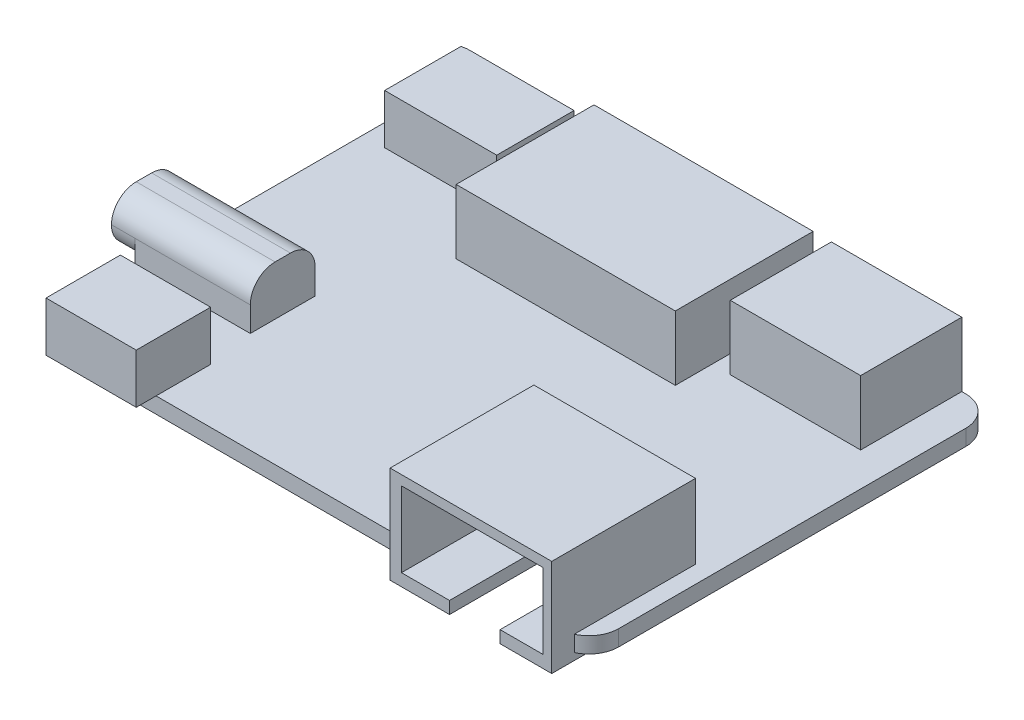
from build123d import *

# Parameters (mm, degrees)
BOSS_EXTRUDE1_DEPTH      = 1.6
BOSS_EXTRUDE2_DEPTH      = 9.1
BOSS_EXTRUDE2_DEPTH_BACK = 0.7
BOSS_EXTRUDE3_START      = 1.6
SKETCH1_4_W              = 22.1
SKETCH1_4_H              = 13.9
SKETCH1_4_W_2            = 13.15
SKETCH1_4_H_2            = 10.2
BOSS_EXTRUDE3_DEPTH      = 6.5
BOSS_EXTRUDE4_START      = 1.6
SKETCH1_5_W              = 9.1
SKETCH1_5_H              = 7.5
SKETCH1_5_W_2            = 14
SKETCH1_5_H_2            = 6.55
BOSS_EXTRUDE4_DEPTH      = 5
SKETCH2_W                = 10.965284592
SKETCH2_H                = 1.785046329
CUT_EXTRUDE1_DEPTH       = 9
SKETCH3_W                = 5.100132369
SKETCH3_H                = 1.23427986
SKETCH3_W_2              = 14.280370632
SKETCH3_H_2              = 7.586446898
CUT_EXTRUDE2_DEPTH       = 12
FILLET1_R                = 2.5


with BuildPart() as part:
    # Sketch1 → Boss-Extrude1 (new body)
    with BuildSketch(Plane(origin=(0, 0, 0), x_dir=(1, 0, 0), z_dir=(0, 1, 0))):
        with BuildLine():
            ThreePointArc((0, 3), (0.878679656, 0.878679656), (3, 0))
            Line((3, 0), (53, 0))
            ThreePointArc((53, 0), (55.121320344, 0.878679656), (56, 3))
            Line((56, 3), (56, 38))
            ThreePointArc((56, 38), (55.121320344, 40.121320344), (53, 41))
            Line((53, 41), (3, 41))
            ThreePointArc((3, 41), (0.878679656, 40.121320344), (0, 38))
            Line((0, 38), (0, 3))
        make_face()
    extrude(amount=BOSS_EXTRUDE1_DEPTH)

    # Sketch1<3> → Boss-Extrude2 (add, two sides: drawn at the far end of the back side and taken through both)
    with BuildSketch(Plane(origin=(0, 0, 0), x_dir=(1, 0, 0), z_dir=(0, 1, 0)).offset(-BOSS_EXTRUDE2_DEPTH_BACK)):
        with BuildLine():
            Line((37.95, 12.5), (37.95, 0))
            Line((37.95, 0), (53, 0))
            ThreePointArc((53, 0), (53.639713183, 0.068998969), (54.25, 0.272821971))
            Line((54.25, 0.272821971), (54.25, 12.5))
            Line((54.25, 12.5), (37.95, 12.5))
        make_face()
        with BuildLine():
            Line((53, 0), (37.95, 0))
            Line((37.95, 0), (37.95, -2))
            Line((37.95, -2), (54.25, -2))
            Line((54.25, -2), (54.25, 0.272821971))
            ThreePointArc((54.25, 0.272821971), (53.639713183, 0.068998969), (53, 0))
        make_face()
    extrude(amount=BOSS_EXTRUDE2_DEPTH + BOSS_EXTRUDE2_DEPTH_BACK)

    # Sketch1<4> → Boss-Extrude3 (add)
    with BuildSketch(Plane(origin=(0, 0, 0), x_dir=(1, 0, 0), z_dir=(0, 1, 0)).offset(BOSS_EXTRUDE3_START)):
        with Locations((26.561479759, 34.05)):
            Rectangle(SKETCH1_4_W, SKETCH1_4_H)
        with Locations((46.025, 35.9)):
            Rectangle(SKETCH1_4_W_2, SKETCH1_4_H_2)
    extrude(amount=BOSS_EXTRUDE3_DEPTH)

    # Sketch1<5> → Boss-Extrude4 (add)
    with BuildSketch(Plane(origin=(0, 0, 0), x_dir=(1, 0, 0), z_dir=(0, 1, 0)).offset(BOSS_EXTRUDE4_START)):
        with Locations((7.8, 1.75)):
            Rectangle(SKETCH1_5_W, SKETCH1_5_H)
        with Locations((4.65, 13.475)):
            Rectangle(SKETCH1_5_W_2, SKETCH1_5_H_2)
        with BuildLine():
            ThreePointArc((3, 41), (2.596328956, 40.972717559), (2.2, 40.891366459))
            Line((2.2, 40.891366459), (2.2, 33.2))
            Line((2.2, 33.2), (13.5, 33.2))
            Line((13.5, 33.2), (13.5, 41))
            Line((13.5, 41), (3, 41))
        make_face()
    extrude(amount=BOSS_EXTRUDE4_DEPTH)

    # Sketch2 → Cut-Extrude1 (cut)
    with BuildSketch(Plane(origin=(0, 0, -41), x_dir=(-1, 0, 0), z_dir=(0, 0, -1))):
        with Locations((-45.98237221, 5.889418847)):
            Rectangle(SKETCH2_W, SKETCH2_H)
    extrude(amount=-CUT_EXTRUDE1_DEPTH, mode=Mode.SUBTRACT)

    # Sketch3 → Cut-Extrude2 (cut)
    with BuildSketch(Plane.XY.offset(2)):
        with Locations((46.492385447, -0.08286007)):
            Rectangle(SKETCH3_W, SKETCH3_H)
        with Locations((46.237378828, 4.327503309)):
            Rectangle(SKETCH3_W_2, SKETCH3_H_2)
    extrude(amount=-CUT_EXTRUDE2_DEPTH, mode=Mode.SUBTRACT)

    # Fillet1
    fillet1_edges = [part.edges().sort_by_distance(p)[0] for p in [
        (-1.175, 1.6, -16.75),
        (-1.175, 1.6, -10.2),
        (4.65, 6.6, -16.75),
        (4.65, 6.6, -10.2),
    ]]
    fillet(fillet1_edges, radius=FILLET1_R - 0.0001)  # a hair under: the kernel refuses the full size


solid = part.part
